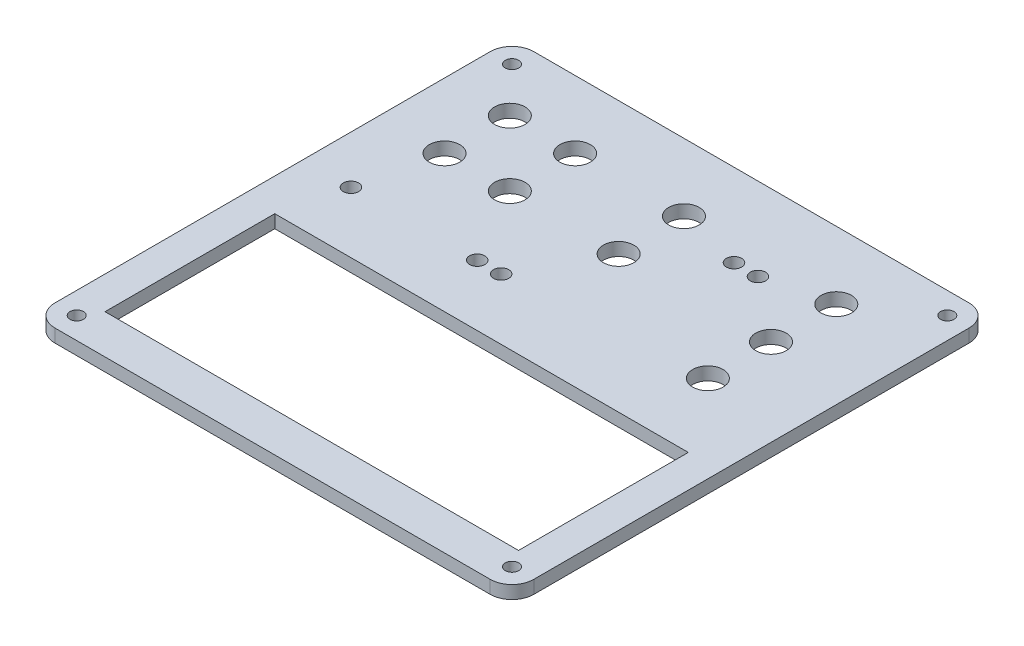
from build123d import *

# Parameters (mm, degrees)
SKETCH1_W           = 110
SKETCH1_H           = 110
SKETCH1_R           = 1.55
BOSS_EXTRUDE1_DEPTH = 3
FILLET1_R           = 5
SKETCH2_W           = 95
SKETCH2_H           = 39
CUT_EXTRUDE1_DEPTH  = 78.839578622
SKETCH3_R           = 3.5
CUT_EXTRUDE2_DEPTH  = 78.839578622
SKETCH4_R           = 1.75
CUT_EXTRUDE3_DEPTH  = 78.839578622


with BuildPart() as part:
    # Sketch1 → Boss-Extrude1 (new body)
    with BuildSketch(Plane(origin=(0, 0, 0), x_dir=(1, 0, 0), z_dir=(0, 1, 0))):
        Rectangle(SKETCH1_W, SKETCH1_H)
        with Locations((-50, 50)):
            Circle(SKETCH1_R, mode=Mode.SUBTRACT)
        with Locations((50, 50)):
            Circle(SKETCH1_R, mode=Mode.SUBTRACT)
        with Locations((50, -50)):
            Circle(SKETCH1_R, mode=Mode.SUBTRACT)
        with Locations((-50, -50)):
            Circle(SKETCH1_R, mode=Mode.SUBTRACT)
    extrude(amount=BOSS_EXTRUDE1_DEPTH)

    # Fillet1
    fillet1_edges = [part.edges().sort_by_distance(p)[0] for p in [
        (-55, 1.5, -55),
        (55, 1.5, -55),
        (55, 1.5, 55),
        (-55, 1.5, 55),
    ]]
    fillet(fillet1_edges, radius=FILLET1_R)

    # Sketch2 → Cut-Extrude1 (cut, through all)
    with BuildSketch(Plane(origin=(0, 3, 0), x_dir=(1, 0, 0), z_dir=(0, 1, 0))):
        with Locations((0, -26.5)):
            Rectangle(SKETCH2_W, SKETCH2_H)
    extrude(amount=-CUT_EXTRUDE1_DEPTH, mode=Mode.SUBTRACT)

    # Sketch3 → Cut-Extrude2 (cut, through all)
    with BuildSketch(Plane(origin=(0, 3, 0), x_dir=(1, 0, 0), z_dir=(0, 1, 0))):
        with Locations((-40, 39.5)):
            Circle(SKETCH3_R)
        with Locations((-40, 24.5)):
            Circle(SKETCH3_R)
        with Locations((-25, 39.5)):
            Circle(SKETCH3_R)
        with Locations((-25, 24.5)):
            Circle(SKETCH3_R)
        with Locations((0, 39.5)):
            Circle(SKETCH3_R)
        with Locations((0, 24.5)):
            Circle(SKETCH3_R)
        with Locations((35, 39.5)):
            Circle(SKETCH3_R)
        with Locations((35, 24.5)):
            Circle(SKETCH3_R)
        with Locations((35, 10)):
            Circle(SKETCH3_R)
    extrude(amount=-CUT_EXTRUDE2_DEPTH, mode=Mode.SUBTRACT)

    # Sketch4 → Cut-Extrude3 (cut, through all)
    with BuildSketch(Plane(origin=(0, 3, 0), x_dir=(1, 0, 0), z_dir=(0, 1, 0))):
        with Locations((-44, 7)):
            Circle(SKETCH4_R)
        with Locations((-15, 7)):
            Circle(SKETCH4_R)
        with Locations((-9.5, 7)):
            Circle(SKETCH4_R)
        with Locations((15, 36)):
            Circle(SKETCH4_R)
        with Locations((20.5, 36)):
            Circle(SKETCH4_R)
    extrude(amount=-CUT_EXTRUDE3_DEPTH, mode=Mode.SUBTRACT)


solid = part.part
